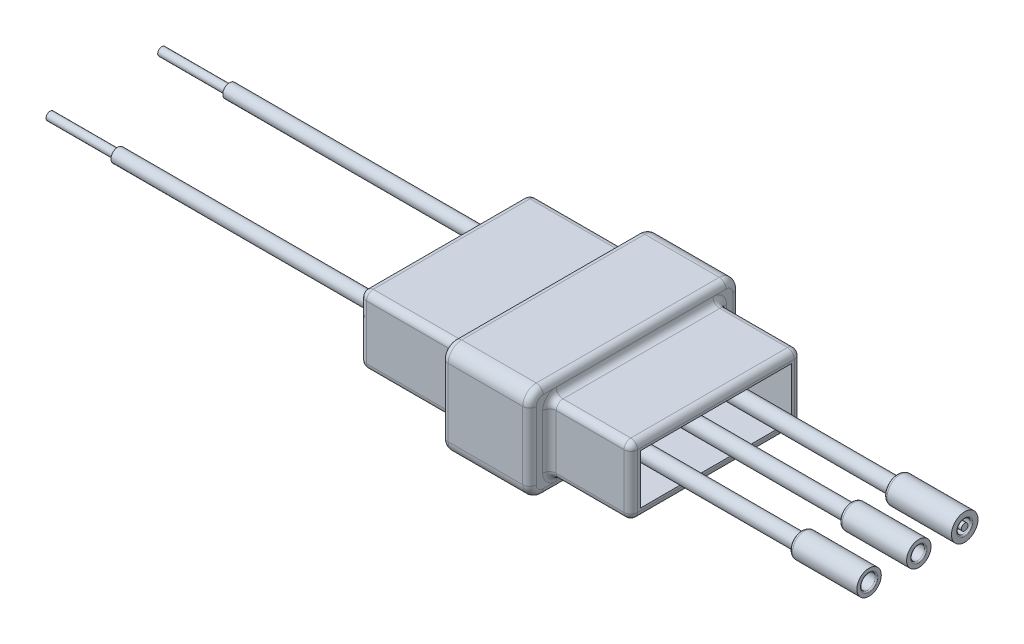
from build123d import *

# Parameters (mm, degrees)
SKETCH1_W                  = 40
SKETCH1_H                  = 31
BOSS_EXTRUDE1_DEPTH        = 14
CUT_EXTRUDE4_REACH         = 54.507
SKETCH5_W                  = 15
SKETCH5_H                  = 2
SKETCH5_W_2                = 12
CUT_EXTRUDE5_REACH         = 54.507
SKETCH6_W                  = 12
SKETCH6_H                  = 2.942561473
SKETCH6_W_2                = 15
SKETCH6_H_2                = 2.951265474
FILLET4_R                  = 1
SKETCH7_W                  = 22.225856006
SKETCH7_H                  = 7.321457
CUT_EXTRUDE6_DEPTH         = 10
SKETCH8_R                  = 1.1
BOSS_EXTRUDE2_DEPTH        = 30
SKETCH9_R                  = 1.8
SKETCH9_R_2                = 1.1
SKETCH9_R_3                = 1.016647114
SKETCH9_R_4                = 1.957544334
SKETCH9_R_5                = 0.992240875
BOSS_EXTRUDE3_DEPTH        = 10
FILLET5_R                  = 0.5
FILLET6_R                  = 0.5
FILLET7_R                  = 0.2
FILLET8_R                  = 0.2
SKETCH11_R                 = 0.5
BOSS_EXTRUDE5_DEPTH        = 10
BOSS_EXTRUDE6_DEPTH        = 40
BOSS_EXTRUDE6_DEPTH_BACK   = 12
SKETCH12_R                 = 1
BOSS_EXTRUDE6_2_DEPTH      = 40
BOSS_EXTRUDE6_2_DEPTH_BACK = 12
SKETCH13_R                 = 0.6
BOSS_EXTRUDE7_DEPTH        = 10
BOSS_EXTRUDE7_2_DEPTH      = 10
SKETCH14_W                 = 21.561403949
SKETCH14_H                 = 6.543510651
CUT_EXTRUDE8_DEPTH         = 12
FILLET10_R                 = 2


# Some blends are built 0.0001 mm under size
with BuildPart() as part:
    # Sketch1 → Boss-Extrude1 (new body)
    with BuildSketch(Plane(origin=(0, 0, 0), x_dir=(1, 0, 0), z_dir=(0, 1, 0))):
        with Locations((20, 15.5)):
            Rectangle(SKETCH1_W, SKETCH1_H)
    extrude(amount=BOSS_EXTRUDE1_DEPTH)

    # Sketch5 → Cut-Extrude4 (cut, up to next)
    with BuildSketch(Plane.XY, mode=Mode.PRIVATE) as cut_extrude4_sk1:
        with Locations((7.5, 13)):
            Rectangle(SKETCH5_W, SKETCH5_H)
    cut_extrude4_tool1 = extrude(cut_extrude4_sk1.sketch, amount=-CUT_EXTRUDE4_REACH, mode=Mode.PRIVATE) & part.part
    # Sketch5 → Cut-Extrude4 (cut, up to next)
    with BuildSketch(Plane.XY, mode=Mode.PRIVATE) as cut_extrude4_sk2:
        with Locations((7.5, 1)):
            Rectangle(SKETCH5_W, SKETCH5_H)
    cut_extrude4_tool2 = extrude(cut_extrude4_sk2.sketch, amount=-CUT_EXTRUDE4_REACH, mode=Mode.PRIVATE) & part.part
    # Sketch5 → Cut-Extrude4 (cut, up to next)
    with BuildSketch(Plane.XY, mode=Mode.PRIVATE) as cut_extrude4_sk3:
        with Locations((34, 1)):
            Rectangle(SKETCH5_W_2, SKETCH5_H)
    cut_extrude4_tool3 = extrude(cut_extrude4_sk3.sketch, amount=-CUT_EXTRUDE4_REACH, mode=Mode.PRIVATE) & part.part
    # Sketch5 → Cut-Extrude4 (cut, up to next)
    with BuildSketch(Plane.XY, mode=Mode.PRIVATE) as cut_extrude4_sk4:
        with Locations((34, 13)):
            Rectangle(SKETCH5_W_2, SKETCH5_H)
    cut_extrude4_tool4 = extrude(cut_extrude4_sk4.sketch, amount=-CUT_EXTRUDE4_REACH, mode=Mode.PRIVATE) & part.part
    add(cut_extrude4_tool1.solids().sort_by_distance((7.5, 13, 0))[0], mode=Mode.SUBTRACT)
    add(cut_extrude4_tool2.solids().sort_by_distance((7.5, 1, 0))[0], mode=Mode.SUBTRACT)
    add(cut_extrude4_tool3.solids().sort_by_distance((34, 1, 0))[0], mode=Mode.SUBTRACT)
    add(cut_extrude4_tool4.solids().sort_by_distance((34, 13, 0))[0], mode=Mode.SUBTRACT)

    # Sketch6 → Cut-Extrude5 (cut, up to next)
    with BuildSketch(Plane(origin=(0, 0, 0), x_dir=(1, 0, 0), z_dir=(0, 1, 0)), mode=Mode.PRIVATE) as cut_extrude5_sk1:
        with Locations((34, 29.528719264)):
            Rectangle(SKETCH6_W, SKETCH6_H)
    cut_extrude5_tool1 = extrude(cut_extrude5_sk1.sketch, amount=CUT_EXTRUDE5_REACH, mode=Mode.PRIVATE) & part.part
    # Sketch6 → Cut-Extrude5 (cut, up to next)
    with BuildSketch(Plane(origin=(0, 0, 0), x_dir=(1, 0, 0), z_dir=(0, 1, 0)), mode=Mode.PRIVATE) as cut_extrude5_sk2:
        with Locations((7.5, 1.475632737)):
            Rectangle(SKETCH6_W_2, SKETCH6_H_2)
    cut_extrude5_tool2 = extrude(cut_extrude5_sk2.sketch, amount=CUT_EXTRUDE5_REACH, mode=Mode.PRIVATE) & part.part
    # Sketch6 → Cut-Extrude5 (cut, up to next)
    with BuildSketch(Plane(origin=(0, 0, 0), x_dir=(1, 0, 0), z_dir=(0, 1, 0)), mode=Mode.PRIVATE) as cut_extrude5_sk3:
        with Locations((7.5, 29.524367263)):
            Rectangle(SKETCH6_W_2, SKETCH6_H_2)
    cut_extrude5_tool3 = extrude(cut_extrude5_sk3.sketch, amount=CUT_EXTRUDE5_REACH, mode=Mode.PRIVATE) & part.part
    # Sketch6 → Cut-Extrude5 (cut, up to next)
    with BuildSketch(Plane(origin=(0, 0, 0), x_dir=(1, 0, 0), z_dir=(0, 1, 0)), mode=Mode.PRIVATE) as cut_extrude5_sk4:
        with Locations((34, 1.471280737)):
            Rectangle(SKETCH6_W, SKETCH6_H)
    cut_extrude5_tool4 = extrude(cut_extrude5_sk4.sketch, amount=CUT_EXTRUDE5_REACH, mode=Mode.PRIVATE) & part.part
    add(cut_extrude5_tool1.solids().sort_by_distance((34, 0, -29.528719))[0], mode=Mode.SUBTRACT)
    add(cut_extrude5_tool2.solids().sort_by_distance((7.5, 0, -1.475633))[0], mode=Mode.SUBTRACT)
    add(cut_extrude5_tool3.solids().sort_by_distance((7.5, 0, -29.524367))[0], mode=Mode.SUBTRACT)
    add(cut_extrude5_tool4.solids().sort_by_distance((34, 0, -1.471281))[0], mode=Mode.SUBTRACT)

    # Fillet4
    fillet4_edges = [part.edges().sort_by_distance(p)[0] for p in [
        (15, 14, -15.5),
        (15, 7, 0),
        (15, 7, -31),
        (15, 0, -15.5),
        (28, 14, -15.5),
        (28, 7, 0),
        (28, 7, -31),
        (28, 0, -15.5),
        (15, 2, -15.5),
        (0, 2, -15.5),
        (0, 12, -15.5),
        (15, 12, -15.5),
        (7.5, 12, -28.048734526),
        (0, 7, -28.048734526),
        (7.5, 2, -28.048734526),
        (15, 7, -28.048734526),
        (28, 12, -15.5),
        (40, 12, -15.5),
        (40, 2, -15.5),
        (28, 2, -15.5),
        (0, 7, -2.951265474),
        (7.5, 12, -2.951265474),
        (15, 7, -2.951265474),
        (7.5, 2, -2.951265474),
        (28, 7, -28.057438527),
        (34, 2, -28.057438527),
        (34, 12, -28.057438527),
        (40, 7, -28.057438527),
        (28, 7, -2.942561473),
        (40, 7, -2.942561473),
        (34, 2, -2.942561473),
        (34, 12, -2.942561473),
    ]]
    fillet(fillet4_edges, radius=FILLET4_R - 0.0001)  # a hair under: the kernel refuses the full size

    # Sketch7 → Cut-Extrude6 (cut)
    with BuildSketch(Plane(origin=(40, 0, 0), x_dir=(0, 0, -1), z_dir=(1, 0, 0))):
        with Locations((15.5, 7)):
            Rectangle(SKETCH7_W, SKETCH7_H)
    extrude(amount=-CUT_EXTRUDE6_DEPTH, mode=Mode.SUBTRACT)

    # Sketch8 → Boss-Extrude2 (add)
    with BuildSketch(Plane(origin=(30, 0, 0), x_dir=(0, 0, -1), z_dir=(1, 0, 0))):
        with Locations(Location((15.5, 7, 0), (0, 0, 180))):
            Circle(SKETCH8_R)
        with Locations(Location((8.094977578, 7, 0), (0, 0, 180))):
            Circle(SKETCH8_R)
        with Locations(Location((22.205021777, 7, 0), (0, 0, 180))):
            Circle(SKETCH8_R)
    extrude(amount=BOSS_EXTRUDE2_DEPTH)

    # Sketch9 → Boss-Extrude3 (add)
    # profile 1 of 3: a face of its own
    with BuildSketch(Plane(origin=(60, 0, 0), x_dir=(0, 0, -1), z_dir=(1, 0, 0))):
        with Locations((8.094977578, 7)):
            Circle(SKETCH9_R)
        with Locations((8.094977578, 7)):
            Circle(SKETCH9_R_2, mode=Mode.SUBTRACT)
    # profile 2 of 3: a face of its own
    with BuildSketch(Plane(origin=(60, 0, 0), x_dir=(0, 0, -1), z_dir=(1, 0, 0))):
        with Locations((15.433013317, 7)):
            Circle(SKETCH9_R)
        with Locations((15.433013317, 7)):
            Circle(SKETCH9_R_3, mode=Mode.SUBTRACT)
    # profile 3 of 3: a face of its own
    with BuildSketch(Plane(origin=(60, 0, 0), x_dir=(0, 0, -1), z_dir=(1, 0, 0))):
        with Locations((22.205021777, 7)):
            Circle(SKETCH9_R_4)
        with Locations((22.205021777, 7)):
            Circle(SKETCH9_R_5, mode=Mode.SUBTRACT)
    extrude(amount=BOSS_EXTRUDE3_DEPTH)


with BuildPart() as boss_extrude3_piece_1:
    # of the separate pieces the step leaves, piece 1, a body of its own (boss_extrude3_pieces)
    add(part.part.solids().sort_by_distance((15.9999, 0, 0))[0])

    # Fillet6
    fillet6_edges = [boss_extrude3_piece_1.edges().sort_by_distance(p)[0] for p in [
        (60, 7, -13.633013317),
        (60, 7, -20.247477443),
    ]]
    fillet(fillet6_edges, radius=FILLET6_R)

    # Fillet8
    fillet8_edges = [boss_extrude3_piece_1.edges().sort_by_distance(p)[0] for p in [
        (70, 7, -14.416366203),
        (70, 7, -21.212780902),
    ]]
    fillet(fillet8_edges, radius=FILLET8_R)

    # Sketch11 → Boss-Extrude5 (add)
    with BuildSketch(Plane(origin=(60, 0, 0), x_dir=(0, 0, -1), z_dir=(1, 0, 0))):
        with Locations((22.205021777, 7)):
            Circle(SKETCH11_R)
    extrude(amount=BOSS_EXTRUDE5_DEPTH)

    # Sketch14 → Cut-Extrude8 (cut)
    with BuildSketch(Plane.ZY):
        with Locations((-15.470247164, 7.026817667)):
            Rectangle(SKETCH14_W, SKETCH14_H)
    extrude(amount=-CUT_EXTRUDE8_DEPTH, mode=Mode.SUBTRACT)

    # Fillet10
    # the kernel refuses this fillet: 2 mm, written as the material it takes off along each edge
    with BuildSketch(Plane(origin=(28, 12, -29), x_dir=(0, 0, -1), z_dir=(0, -1, 0))) as fillet10_piece_1:
        with BuildLine():
            CenterArc((1.0001, -0.9999), 0.9999, 0, 90)
            Line((2, -0.9999), (2, 0))
            Line((2, 0), (1.0001, 0))
        make_face()
    revolve(axis=Axis((28, 12, -29), (1, 0, 0)), revolution_arc=90, mode=Mode.SUBTRACT)
    with BuildSketch(Plane(origin=(28, 12, -2), x_dir=(0, 1, 0), z_dir=(0, 0, -1))) as fillet10_piece_2:
        with BuildLine():
            CenterArc((1.0001, -0.9999), 0.9999, 0, 90)
            Line((2, -0.9999), (2, 0))
            Line((2, 0), (1.0001, 0))
        make_face()
    revolve(axis=Axis((28, 12, -2), (1, 0, 0)), revolution_arc=90, mode=Mode.SUBTRACT)
    with BuildSketch(Plane(origin=(28, 2, -29), x_dir=(0, -1, 0), z_dir=(0, 0, 1))) as fillet10_piece_3:
        with BuildLine():
            CenterArc((1.0001, -0.9999), 0.9999, 0, 90)
            Line((2, -0.9999), (2, 0))
            Line((2, 0), (1.0001, 0))
        make_face()
    revolve(axis=Axis((28, 2, -29), (1, 0, 0)), revolution_arc=90, mode=Mode.SUBTRACT)
    with BuildSketch(Plane(origin=(28, 2, -2), x_dir=(0, 0, 1), z_dir=(0, 1, 0))) as fillet10_piece_4:
        with BuildLine():
            CenterArc((1.0001, -0.9999), 0.9999, 0, 90)
            Line((2, -0.9999), (2, 0))
            Line((2, 0), (1.0001, 0))
        make_face()
    revolve(axis=Axis((28, 2, -2), (1, 0, 0)), revolution_arc=90, mode=Mode.SUBTRACT)
    with BuildSketch(Plane(origin=(15, 12, -2), x_dir=(0, 0, 1), z_dir=(0, -1, 0))) as fillet10_piece_5:
        with BuildLine():
            CenterArc((1.0001, -0.9999), 0.9999, 0, 90)
            Line((2, -0.9999), (2, 0))
            Line((2, 0), (1.0001, 0))
        make_face()
    revolve(axis=Axis((15, 12, -2), (-1, 0, 0)), revolution_arc=90, mode=Mode.SUBTRACT)
    with BuildSketch(Plane(origin=(15, 2, -2), x_dir=(0, -1, 0), z_dir=(0, 0, -1))) as fillet10_piece_6:
        with BuildLine():
            CenterArc((1.0001, -0.9999), 0.9999, 0, 90)
            Line((2, -0.9999), (2, 0))
            Line((2, 0), (1.0001, 0))
        make_face()
    revolve(axis=Axis((15, 2, -2), (-1, 0, 0)), revolution_arc=90, mode=Mode.SUBTRACT)
    with BuildSketch(Plane(origin=(15, 12, -29), x_dir=(0, 1, 0), z_dir=(0, 0, 1))) as fillet10_piece_7:
        with BuildLine():
            CenterArc((1.0001, -0.9999), 0.9999, 0, 90)
            Line((2, -0.9999), (2, 0))
            Line((2, 0), (1.0001, 0))
        make_face()
    revolve(axis=Axis((15, 12, -29), (-1, 0, 0)), revolution_arc=90, mode=Mode.SUBTRACT)
    with BuildSketch(Plane(origin=(15, 2, -29), x_dir=(0, 0, -1), z_dir=(0, 1, 0))) as fillet10_piece_8:
        with BuildLine():
            CenterArc((1.0001, -0.9999), 0.9999, 0, 90)
            Line((2, -0.9999), (2, 0))
            Line((2, 0), (1.0001, 0))
        make_face()
    revolve(axis=Axis((15, 2, -29), (-1, 0, 0)), revolution_arc=90, mode=Mode.SUBTRACT)
    with BuildSketch(Plane(origin=(28, 0, -31), x_dir=(0, 1, 0), z_dir=(-1, 0, 0)), Plane(origin=(15, 0, 0), x_dir=(0, 1, 0), z_dir=(1, 0, 0)), Plane(origin=(15, 14, 0), x_dir=(0, 0, -1), z_dir=(1, 0, 0)), Plane(origin=(28, 14, -31), x_dir=(0, 0, 1), z_dir=(-1, 0, 0))) as fillet10_piece_9:
        with BuildLine():
            CenterArc((FILLET10_R, -FILLET10_R), FILLET10_R, 90, 90)
            Line((0, -FILLET10_R), (0, 0))
            Line((0, 0), (FILLET10_R, 0))
        make_face()
    extrude(amount=13, mode=Mode.SUBTRACT)


with BuildPart() as boss_extrude3_piece_2:
    # of the separate pieces the step leaves, piece 2, a body of its own (boss_extrude3_pieces)
    add(part.part.solids().sort_by_distance((70, 7, -9.194977578))[0])

    # Fillet5
    fillet5_edges = [boss_extrude3_piece_2.edges().sort_by_distance(p)[0] for p in [
        (60, 7, -6.294977578),
    ]]
    fillet(fillet5_edges, radius=FILLET5_R)

    # Fillet7
    fillet7_edges = [boss_extrude3_piece_2.edges().sort_by_distance(p)[0] for p in [
        (70, 7, -6.994977578),
    ]]
    fillet(fillet7_edges, radius=FILLET7_R)


with BuildPart() as body_3:
    # Sketch12 → Boss-Extrude6 (new, two sides: drawn at the far end of the back side and taken through both)
    with BuildSketch(Plane.ZY.offset(-BOSS_EXTRUDE6_DEPTH_BACK)):
        with Locations((-23.748734526, 7)):
            Circle(SKETCH12_R)
    extrude(amount=BOSS_EXTRUDE6_DEPTH + BOSS_EXTRUDE6_DEPTH_BACK)


with BuildPart() as body_4:
    # Sketch12 → Boss-Extrude6 2 (new, two sides: drawn at the far end of the back side and taken through both)
    with BuildSketch(Plane.ZY.offset(-BOSS_EXTRUDE6_2_DEPTH_BACK)):
        with Locations((-7.251265474, 7)):
            Circle(SKETCH12_R)
    extrude(amount=BOSS_EXTRUDE6_2_DEPTH + BOSS_EXTRUDE6_2_DEPTH_BACK)


with BuildPart() as body_5:
    # Sketch13 → Boss-Extrude7 (new body)
    with BuildSketch(Plane.ZY.offset(40)):
        with Locations((-23.748734526, 7)):
            Circle(SKETCH13_R)
    extrude(amount=BOSS_EXTRUDE7_DEPTH)


with BuildPart() as body_6:
    # Sketch13 → Boss-Extrude7 2 (new body)
    with BuildSketch(Plane.ZY.offset(40)):
        with Locations((-7.269270881, 7)):
            Circle(SKETCH13_R)
    extrude(amount=BOSS_EXTRUDE7_2_DEPTH)


solid = Compound([boss_extrude3_piece_1.part, boss_extrude3_piece_2.part, body_3.part, body_4.part, body_5.part, body_6.part])
